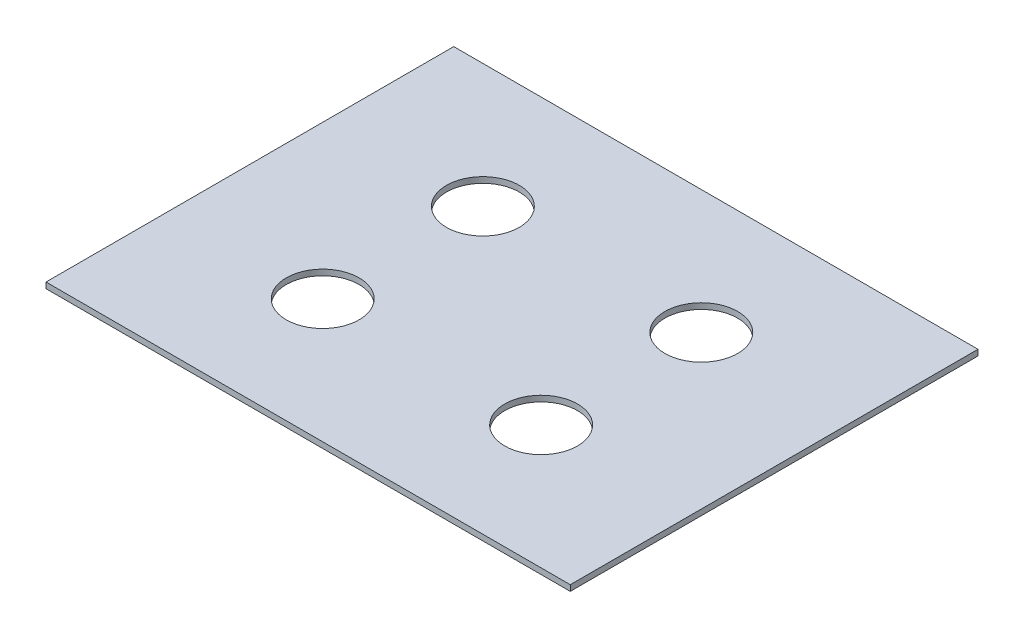
from build123d import *

# Parameters (mm, degrees)
SKETCH1_W           = 228.6
SKETCH1_H           = 177.8
BOSS_EXTRUDE1_DEPTH = 2.54
SKETCH2_R           = 15.875
CUT_EXTRUDE1_DEPTH  = 145.824554548


with BuildPart() as part:
    # Sketch1 → Boss-Extrude1 (new body)
    with BuildSketch(Plane(origin=(0, 0, 0), x_dir=(1, 0, 0), z_dir=(0, 1, 0))):
        Rectangle(SKETCH1_W, SKETCH1_H)
    extrude(amount=BOSS_EXTRUDE1_DEPTH)

    # Sketch2 → Cut-Extrude1 (cut, through all)
    with BuildSketch(Plane(origin=(0, 2.54, 0), x_dir=(1, 0, 0), z_dir=(0, 1, 0))):
        with Locations((-47.625, 34.925)):
            Circle(SKETCH2_R)
        with Locations((47.625, 34.925)):
            Circle(SKETCH2_R)
        with Locations((47.625, -34.925)):
            Circle(SKETCH2_R)
        with Locations((-47.625, -34.925)):
            Circle(SKETCH2_R)
    extrude(amount=-CUT_EXTRUDE1_DEPTH, mode=Mode.SUBTRACT)


solid = part.part
